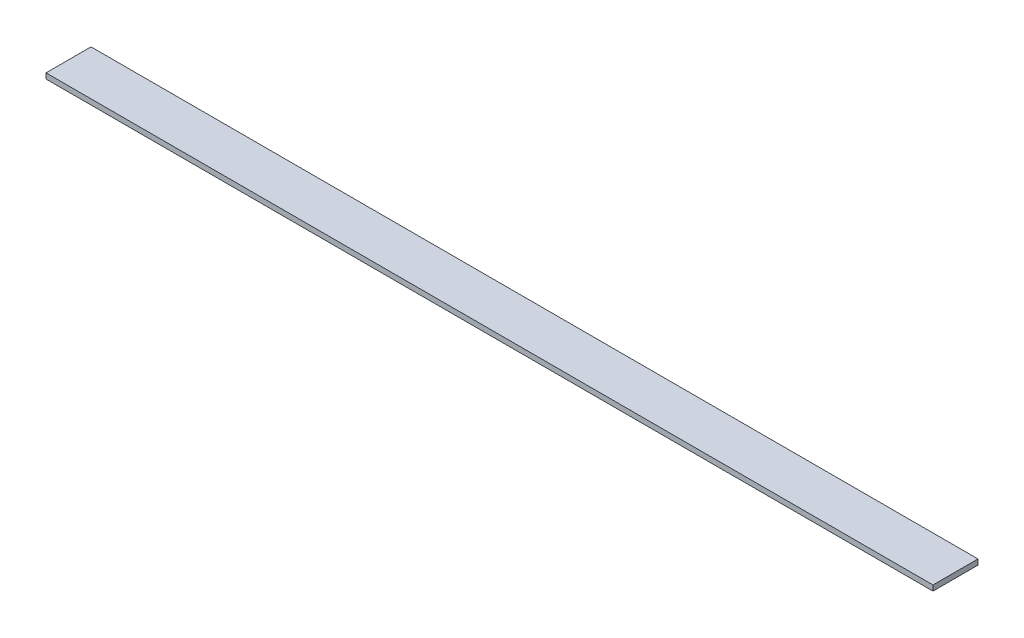
from build123d import *

# Parameters (mm, degrees)
SKETCH1_W           = 16.75
SKETCH1_H           = 2
BOSS_EXTRUDE1_DEPTH = 165


with BuildPart() as part:
    # Sketch1 → Boss-Extrude1 (new, symmetric)
    with BuildSketch(Plane(origin=(0, 0, 0), x_dir=(0, 0, -1), z_dir=(1, 0, 0))):
        Rectangle(SKETCH1_W, SKETCH1_H)
    extrude(amount=BOSS_EXTRUDE1_DEPTH, both=True)


solid = part.part
